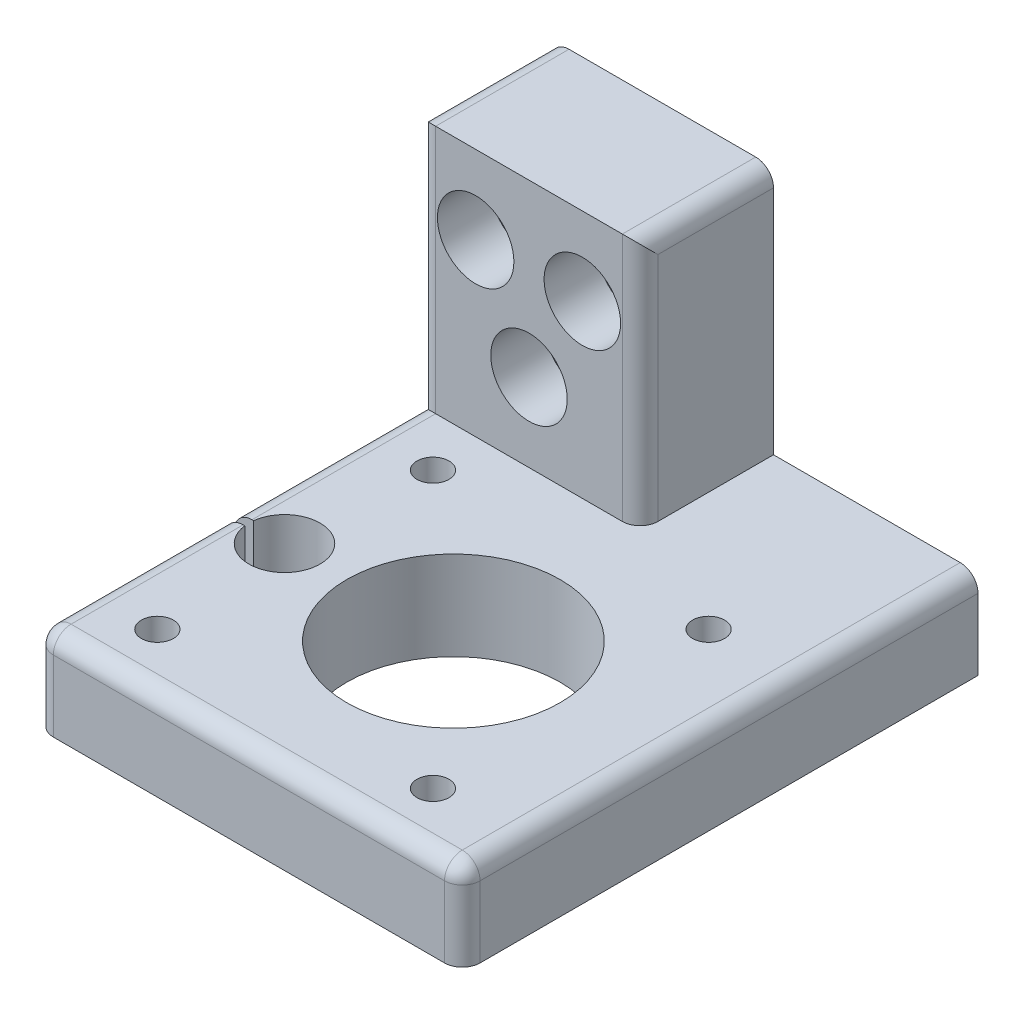
from build123d import *

# Parameters (mm, degrees)
SKETCH1_R           = 1.8
SKETCH1_R_2         = 12
BOSS_EXTRUDE1_DEPTH = 10
SKETCH2_W           = 15
SKETCH2_H           = 28
BOSS_EXTRUDE2_DEPTH = 25
SKETCH3_R           = 2.8
CUT_EXTRUDE1_DEPTH  = 75.813100457
SKETCH4_R           = 4.3
CUT_EXTRUDE2_DEPTH  = 6
FILLET1_R           = 2


with BuildPart() as part:
    # Sketch1 → Boss-Extrude1 (new body)
    with BuildSketch(Plane(origin=(0, 0, 0), x_dir=(1, 0, 0), z_dir=(0, 1, 0))):
        with BuildLine():
            Line((48, 0), (0, 0))
            Line((0, 0), (0, -35.65))
            Line((0, -35.65), (2.181373033, -35.65))
            ThreePointArc((2.181373033, -35.65), (6.40049165, -32.157850963), (10.15, -36.15))
            ThreePointArc((10.15, -36.15), (6.40049165, -40.142149037), (2.181373033, -36.65))
            Line((2.181373033, -36.65), (0, -36.65))
            Line((0, -36.65), (0, -58))
            Line((0, -58), (48, -58))
            Line((48, -58), (48, 0))
        make_face()
        with Locations((7.35, -51.65)):
            Circle(SKETCH1_R, mode=Mode.SUBTRACT)
        with Locations((38.35, -51.65)):
            Circle(SKETCH1_R, mode=Mode.SUBTRACT)
        with Locations((25.15, -36.15)):
            Circle(SKETCH1_R_2, mode=Mode.SUBTRACT)
        with Locations((7.35, -20.65)):
            Circle(SKETCH1_R, mode=Mode.SUBTRACT)
        with Locations((38.35, -20.65)):
            Circle(SKETCH1_R, mode=Mode.SUBTRACT)
    extrude(amount=BOSS_EXTRUDE1_DEPTH)

    # Sketch2 → Boss-Extrude2 (add)
    with BuildSketch(Plane(origin=(0, 0, 0), x_dir=(0, 0, -1), z_dir=(1, 0, 0))):
        with Locations((-7.5, 24)):
            Rectangle(SKETCH2_W, SKETCH2_H)
    extrude(amount=BOSS_EXTRUDE2_DEPTH)

    # Sketch3 → Cut-Extrude1 (cut, through all)
    with BuildSketch(Plane.XY.offset(15)):
        with Locations((6.5, 29.196152423)):
            Circle(SKETCH3_R)
        with Locations((18.5, 29.196152423)):
            Circle(SKETCH3_R)
        with Locations((12.5, 18.803847577)):
            Circle(SKETCH3_R)
    extrude(amount=-CUT_EXTRUDE1_DEPTH, mode=Mode.SUBTRACT)

    # Sketch4 → Cut-Extrude2 (cut)
    with BuildSketch(Plane.XY.offset(15)):
        with Locations((6.5, 29.196152423)):
            Circle(SKETCH4_R)
        with Locations((18.5, 29.196152423)):
            Circle(SKETCH4_R)
        with Locations((12.5, 18.803847577)):
            Circle(SKETCH4_R)
    extrude(amount=-CUT_EXTRUDE2_DEPTH, mode=Mode.SUBTRACT)

    # Fillet1
    fillet1_edges = [part.edges().sort_by_distance(p)[0] for p in [
        (48, 5, 58),
        (0, 5, 58),
        (0, 10, 47.325),
        (24, 10, 58),
        (48, 10, 29),
        (0, 24, 15),
        (0, 38, 7.5),
        (25, 24, 15),
        (25, 38, 7.5),
        (0, 10, 25.325),
    ]]
    fillet(fillet1_edges, radius=FILLET1_R)


solid = part.part
